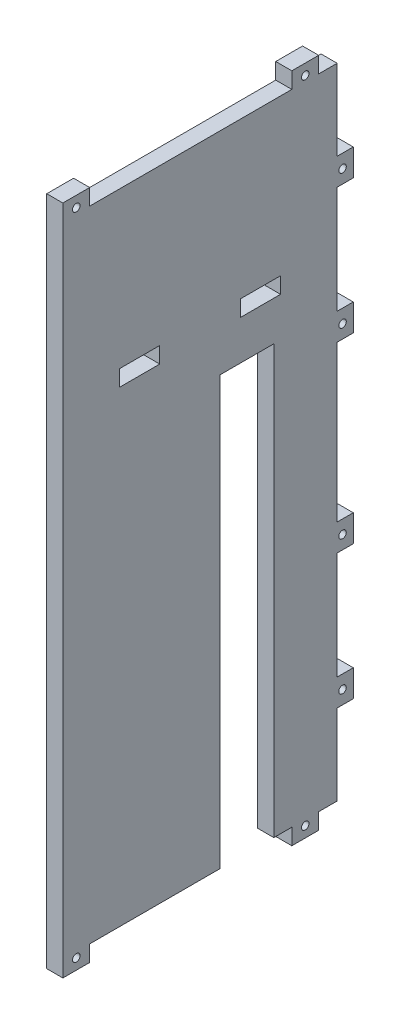
from build123d import *

# Parameters (mm, degrees)
ESQUISSE1_W             = 102.17
ESQUISSE1_H             = 238
ESQUISSE1_W_2           = 15
ESQUISSE1_H_2           = 6
BOSS_EXTRU_1_DEPTH      = 6
ESQUISSE3_W             = 10
ESQUISSE3_H             = 6
ESQUISSE3_W_2           = 6
ESQUISSE3_H_2           = 10
BOSS_EXTRU_5_DEPTH      = 6
ESQUISSE4_R             = 1.4
ENL_V_MAT_EXTRU_1_DEPTH = 6
ESQUISSE6_W             = 20
ESQUISSE6_H             = 159.29
ENL_V_MAT_EXTRU_2_DEPTH = 6


with BuildPart() as part:
    # Esquisse1 → Boss.-Extru.1 (new body)
    with BuildSketch(Plane(origin=(0, 0, 0), x_dir=(0, 0, -1), z_dir=(1, 0, 0))):
        Rectangle(ESQUISSE1_W, ESQUISSE1_H)
        with Locations((-22.5, 58)):
            Rectangle(ESQUISSE1_W_2, ESQUISSE1_H_2, mode=Mode.SUBTRACT)
        with Locations((22.5, 58)):
            Rectangle(ESQUISSE1_W_2, ESQUISSE1_H_2, mode=Mode.SUBTRACT)
    extrude(amount=BOSS_EXTRU_1_DEPTH)

    # Esquisse3 → Boss.-Extru.5 (add)
    with BuildSketch(Plane(origin=(6, 0, 0), x_dir=(0, 0, -1), z_dir=(1, 0, 0))):
        with Locations((-46.085, -122)):
            Rectangle(ESQUISSE3_W, ESQUISSE3_H)
        with Locations((39.205, -122)):
            Rectangle(ESQUISSE3_W, ESQUISSE3_H)
        with Locations((54.085, 84)):
            Rectangle(ESQUISSE3_W_2, ESQUISSE3_H_2)
        with Locations((54.085, 34)):
            Rectangle(ESQUISSE3_W_2, ESQUISSE3_H_2)
        with Locations((54.085, -34)):
            Rectangle(ESQUISSE3_W_2, ESQUISSE3_H_2)
        with Locations((54.085, -84)):
            Rectangle(ESQUISSE3_W_2, ESQUISSE3_H_2)
        with Locations((39.205, 122)):
            Rectangle(ESQUISSE3_W, ESQUISSE3_H)
        with Locations((-46.085, 122)):
            Rectangle(ESQUISSE3_W, ESQUISSE3_H)
    extrude(amount=-BOSS_EXTRU_5_DEPTH)

    # Esquisse4 → Enlèv. mat.-Extru.1 (cut)
    with BuildSketch(Plane(origin=(6, 0, 0), x_dir=(0, 0, -1), z_dir=(1, 0, 0))):
        with Locations((39.205, -121)):
            Circle(ESQUISSE4_R)
        with Locations((53.085, -84)):
            Circle(ESQUISSE4_R)
        with Locations((53.085, -34)):
            Circle(ESQUISSE4_R)
        with Locations((-46.085, 121)):
            Circle(ESQUISSE4_R)
        with Locations((53.085, 34)):
            Circle(ESQUISSE4_R)
        with Locations((53.085, 84)):
            Circle(ESQUISSE4_R)
        with Locations((39.205, 121)):
            Circle(ESQUISSE4_R)
        with Locations((-46.085, -121)):
            Circle(ESQUISSE4_R)
    extrude(amount=-ENL_V_MAT_EXTRU_1_DEPTH, mode=Mode.SUBTRACT)

    # Esquisse6 → Enlèv. mat.-Extru.2 (cut)
    with BuildSketch(Plane(origin=(6, 0, 0), x_dir=(0, 0, -1), z_dir=(1, 0, 0))):
        with Locations((17.485, -39.355)):
            Rectangle(ESQUISSE6_W, ESQUISSE6_H)
    extrude(amount=-ENL_V_MAT_EXTRU_2_DEPTH, mode=Mode.SUBTRACT)


solid = part.part
